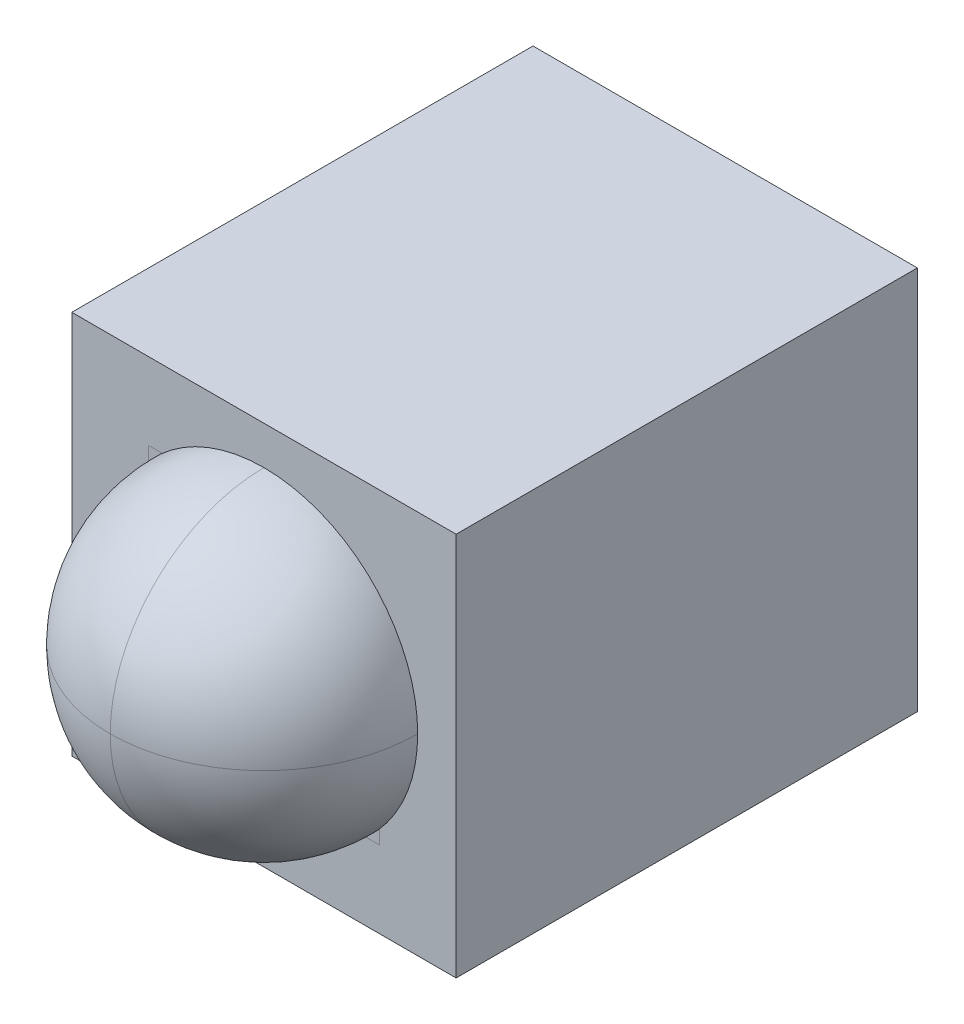
from build123d import *

# Parameters (mm, degrees)
SKETCH1_W           = 2.5
SKETCH1_H           = 2.5
SKETCH1_W_2         = 1.5
SKETCH1_H_2         = 1.5
BOSS_EXTRUDE1_DEPTH = 3
SKETCH2_W           = 2
SKETCH2_H           = 2
BOSS_EXTRUDE3_DEPTH = 1
FILLET1_R           = 1
FILLET2_R           = 1


# Some blends are built 0.0001 mm under size
with BuildPart() as part:
    # Sketch1 → Boss-Extrude1 (new body)
    with BuildSketch(Plane.XY):
        Rectangle(SKETCH1_W, SKETCH1_H)
        Rectangle(SKETCH1_W_2, SKETCH1_H_2, mode=Mode.SUBTRACT)
    extrude(amount=BOSS_EXTRUDE1_DEPTH)

    # Sketch2 → Boss-Extrude3 (add)
    with BuildSketch(Plane.XY.offset(3)):
        Rectangle(SKETCH2_W, SKETCH2_H)
    extrude(amount=BOSS_EXTRUDE3_DEPTH)

    # Fillet1
    fillet1_edges = [part.edges().sort_by_distance(p)[0] for p in [
        (0, -1, 4),
        (1, 0, 4),
        (0, 1, 4),
        (-1, 0, 4),
    ]]
    fillet(fillet1_edges, radius=FILLET1_R - 0.0001)  # a hair under: the kernel refuses the full size

    # Fillet2
    # the kernel refuses this fillet: 1 mm, written as the material it takes off along each edge
    with BuildSketch(Plane(origin=(0, 0, 4), x_dir=(1, 0, 0), z_dir=(0, -1, 0))) as fillet2_piece_1:
        with BuildLine():
            CenterArc((0.0001, -0.9999), 0.9999, 0, 90)
            Line((1, -0.9999), (1, 0))
            Line((1, 0), (0.0001, 0))
        make_face()
    revolve(axis=Axis((0, 0, 4), (0, 0, 1)), revolution_arc=90, mode=Mode.SUBTRACT)
    with BuildSketch(Plane(origin=(0, 0, 4), x_dir=(0, -1, 0), z_dir=(-1, 0, 0))) as fillet2_piece_2:
        with BuildLine():
            CenterArc((0.0001, -0.9999), 0.9999, 0, 90)
            Line((1, -0.9999), (1, 0))
            Line((1, 0), (0.0001, 0))
        make_face()
    revolve(axis=Axis((0, 0, 4), (0, 0, 1)), revolution_arc=90, mode=Mode.SUBTRACT)
    with BuildSketch(Plane(origin=(0, 0, 4), x_dir=(-1, 0, 0), z_dir=(0, 1, 0))) as fillet2_piece_3:
        with BuildLine():
            CenterArc((0.0001, -0.9999), 0.9999, 0, 90)
            Line((1, -0.9999), (1, 0))
            Line((1, 0), (0.0001, 0))
        make_face()
    revolve(axis=Axis((0, 0, 4), (0, 0, 1)), revolution_arc=90, mode=Mode.SUBTRACT)
    with BuildSketch(Plane(origin=(0, 0, 4), x_dir=(0, 1, 0), z_dir=(1, 0, 0))) as fillet2_piece_4:
        with BuildLine():
            CenterArc((0.0001, -0.9999), 0.9999, 0, 90)
            Line((1, -0.9999), (1, 0))
            Line((1, 0), (0.0001, 0))
        make_face()
    revolve(axis=Axis((0, 0, 4), (0, 0, 1)), revolution_arc=90, mode=Mode.SUBTRACT)
    with BuildSketch(Plane(origin=(-1, 1, 3), x_dir=(0, -1, 0), z_dir=(0, 0, 1)), Plane(origin=(-1, -1, 3), x_dir=(1, 0, 0), z_dir=(0, 0, 1))) as fillet2_piece_5:
        with BuildLine():
            CenterArc((FILLET2_R, FILLET2_R), FILLET2_R, 180, 90)
            Line((0, FILLET2_R), (0, 0))
            Line((0, 0), (FILLET2_R, 0))
        make_face()
    extrude(amount=1, mode=Mode.SUBTRACT)
    with BuildSketch(Plane(origin=(1, -1, 3), x_dir=(-1, 0, 0), z_dir=(0, 0, 1)), Plane(origin=(1, 1, 3), x_dir=(0, -1, 0), z_dir=(0, 0, 1))) as fillet2_piece_6:
        with BuildLine():
            CenterArc((FILLET2_R, -FILLET2_R), FILLET2_R, 90, 90)
            Line((0, -FILLET2_R), (0, 0))
            Line((0, 0), (FILLET2_R, 0))
        make_face()
    extrude(amount=1, mode=Mode.SUBTRACT)


solid = part.part
